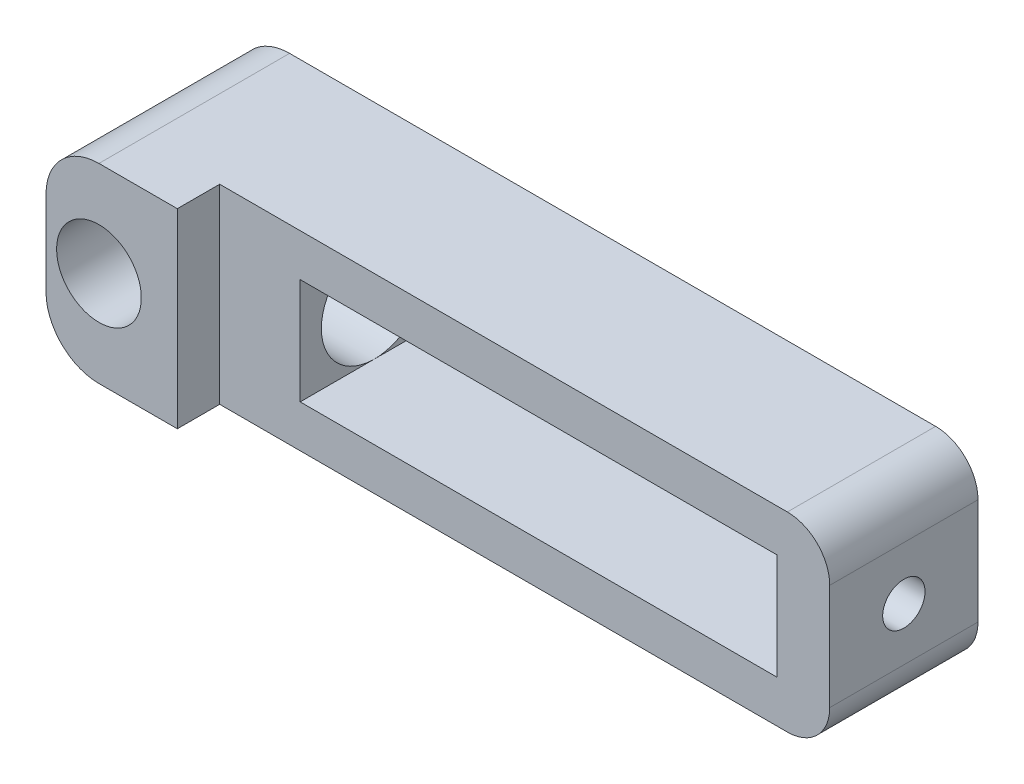
from build123d import *

# Parameters (mm, degrees)
SKETCH_1_W          = 35
SKETCH_1_H          = 9
SKETCH_1_R          = 2
SKETCH_1_W_2        = 22.5
SKETCH_1_H_2        = 5
EXTRUDE_1_DEPTH     = 7
SKETCH_2_W          = 6.2
SKETCH_2_H          = 9
SKETCH_2_R          = 2
EXTRUDE_2_DEPTH     = 4.5
CUT_EXTRUDE_2_REACH = 39.924
SKETCH_3_R          = 1
CUT_EXTRUDE_4_REACH = 30.953
SKETCH_5_R          = 2.5
FILLET_1_R          = 2
SKETCH_10_W         = 6.2
SKETCH_10_H         = 9
CUT_EXTRUDE_7_DEPTH = 2.5
FILLET_3_R          = 2.5


with BuildPart() as part:
    # 草图1 → 凸台-拉伸1 (new body)
    with BuildSketch(Plane.XY):
        with Locations((17.5, -4.5)):
            Rectangle(SKETCH_1_W, SKETCH_1_H)
        with Locations((2.5, -4.5)):
            Circle(SKETCH_1_R, mode=Mode.SUBTRACT)
        with Locations((21.25, -4.5)):
            Rectangle(SKETCH_1_W_2, SKETCH_1_H_2, mode=Mode.SUBTRACT)
    extrude(amount=EXTRUDE_1_DEPTH)

    # 草图2 → 凸台-拉伸2 (add)
    with BuildSketch(Plane.XY.offset(7)):
        with Locations((3.1, -4.5)):
            Rectangle(SKETCH_2_W, SKETCH_2_H)
        with Locations((2.5, -4.5)):
            Circle(SKETCH_2_R, mode=Mode.SUBTRACT)
    extrude(amount=EXTRUDE_2_DEPTH)

    # 草图3 → 切除-拉伸2 (cut, up to next)
    with BuildSketch(Plane(origin=(35, 0, 0), x_dir=(0, 0, -1), z_dir=(1, 0, 0)), mode=Mode.PRIVATE) as cut_extrude_2_sk1:
        with Locations((-3.5, -4.5)):
            Circle(SKETCH_3_R)
    cut_extrude_2_tool1 = extrude(cut_extrude_2_sk1.sketch, amount=-CUT_EXTRUDE_2_REACH, mode=Mode.PRIVATE) & part.part
    add(cut_extrude_2_tool1.solids().sort_by_distance((35, -4.5, 3.5))[0], mode=Mode.SUBTRACT)

    # 草图5 → 切除-拉伸4 (cut, up to next)
    with BuildSketch(Plane(origin=(10, 0, 0), x_dir=(0, 0, -1), z_dir=(1, 0, 0)), mode=Mode.PRIVATE) as cut_extrude_4_sk1:
        with Locations(Location((-3.5, -4.5, 0), (0, 0, 90))):
            Circle(SKETCH_5_R)
    cut_extrude_4_tool1 = extrude(cut_extrude_4_sk1.sketch, amount=-CUT_EXTRUDE_4_REACH, mode=Mode.PRIVATE) & part.part
    add(cut_extrude_4_tool1.solids().sort_by_distance((10, -4.5, 3.5))[0], mode=Mode.SUBTRACT)

    # 圆角1
    fillet_1_edges = [part.edges().sort_by_distance(p)[0] for p in [
        (35, -9, 3.5),
        (35, 0, 3.5),
    ]]
    fillet(fillet_1_edges, radius=FILLET_1_R)

    # 草图10 → 切除-拉伸7 (cut)
    with BuildSketch(Plane.XY.offset(11.5)):
        with Locations((3.1, -4.5)):
            Rectangle(SKETCH_10_W, SKETCH_10_H)
    extrude(amount=-CUT_EXTRUDE_7_DEPTH, mode=Mode.SUBTRACT)

    # 圆角3
    # the kernel refuses this fillet: 2.5 mm, written as the material it takes off along each edge
    with BuildSketch(Plane(origin=(0, 0, -6.25), x_dir=(1, 0, 0), z_dir=(0, 0, 1)), Plane(origin=(0, -9, -6.25), x_dir=(0, 1, 0), z_dir=(0, 0, 1))) as fillet_3_piece_1:
        with BuildLine():
            CenterArc((FILLET_3_R, -FILLET_3_R), FILLET_3_R, 90, 90)
            Line((0, -FILLET_3_R), (0, 0))
            Line((0, 0), (FILLET_3_R, 0))
        make_face()
    extrude(amount=21.5, mode=Mode.SUBTRACT)


solid = part.part
